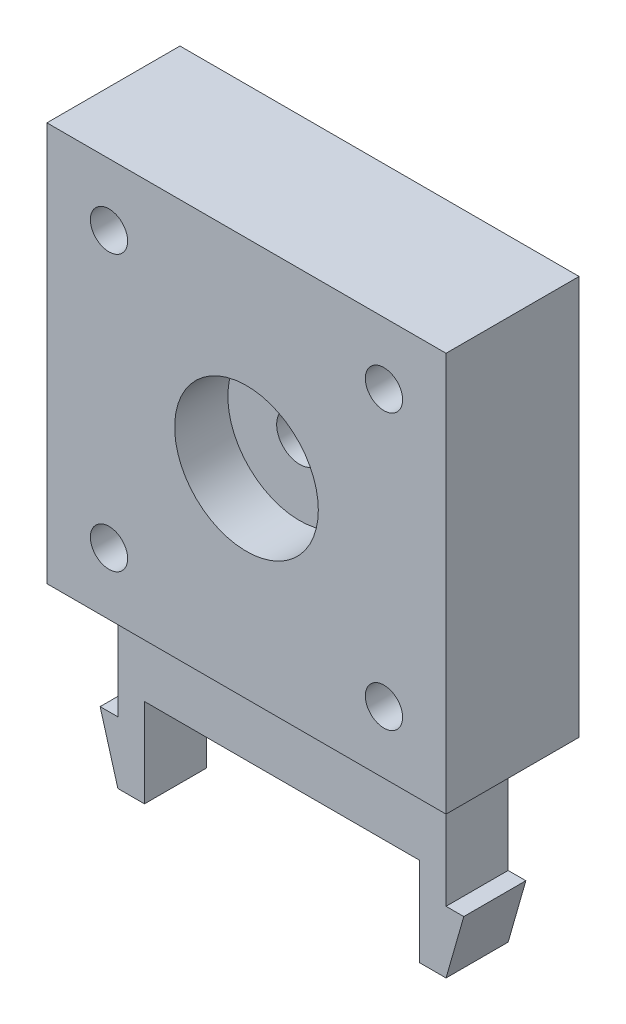
from build123d import *

# Parameters (mm, degrees)
SKETCH1_W           = 45
SKETCH1_H           = 45
SKETCH1_R           = 2.6
BOSS_EXTRUDE1_DEPTH = 7.5
SKETCH2_R           = 8.1
CUT_EXTRUDE1_DEPTH  = 6
CUT_EXTRUDE4_START  = -6
SKETCH5_R           = 8.1
CUT_EXTRUDE4_DEPTH  = 6
SKETCH7_W           = 37
SKETCH7_H           = 7
BOSS_EXTRUDE2_DEPTH = 10
CUT_EXTRUDE6_START  = 2
CUT_EXTRUDE6_DEPTH  = 3.6
CUT_EXTRUDE7_START  = -2
SKETCH8_R           = 2.1
CUT_EXTRUDE7_DEPTH  = 41.278836313
SKETCH9_W           = 3
SKETCH9_H           = 7
BOSS_EXTRUDE3_DEPTH = 10
SKETCH10_W          = 7
SKETCH10_H          = 7
BOSS_EXTRUDE4_DEPTH = 2
CHAMFER2_SIZE2      = 7
CHAMFER2_SIZE       = 2
CHAMFER3_SIZE2      = 7
CHAMFER3_SIZE       = 2


with BuildPart() as part:
    # Sketch1 → Boss-Extrude1 (new, symmetric)
    with BuildSketch(Plane.XY):
        Rectangle(SKETCH1_W, SKETCH1_H)
        Circle(SKETCH1_R, mode=Mode.SUBTRACT)
    extrude(amount=BOSS_EXTRUDE1_DEPTH, both=True)

    # Sketch2 → Cut-Extrude1 (cut)
    with BuildSketch(Plane.XY.offset(7.5)):
        Circle(SKETCH2_R)
    extrude(amount=-CUT_EXTRUDE1_DEPTH, mode=Mode.SUBTRACT)

    # Sketch5 → Cut-Extrude4 (cut)
    with BuildSketch(Plane(origin=(0, 0, -7.5), x_dir=(-1, 0, 0), z_dir=(0, 0, -1)).offset(CUT_EXTRUDE4_START)):
        with Locations(Location((0, 0, 0), (0, 0, 180))):
            Circle(SKETCH5_R)
    extrude(amount=CUT_EXTRUDE4_DEPTH, mode=Mode.SUBTRACT)

    # Sketch7 → Boss-Extrude2 (add)
    with BuildSketch(Plane.XZ.offset(22.5)):
        Rectangle(SKETCH7_W, SKETCH7_H)
    extrude(amount=BOSS_EXTRUDE2_DEPTH)

    # Sketch6 → Cut-Extrude6 (cut)
    with BuildSketch(Plane.XY.offset(-7.5).offset(CUT_EXTRUDE6_START)):
        Polygon((19.2, 17.636195996), (15.5, 19.772391992), (11.8, 17.636195996), (11.8, 13.363804004), (15.5, 11.227608008), (19.2, 13.363804004), align=None)
        Polygon((-11.8, 17.636195996), (-15.5, 19.772391992), (-19.2, 17.636195996), (-19.2, 13.363804004), (-15.5, 11.227608008), (-11.8, 13.363804004), align=None)
        Polygon((19.2, -13.363804004), (15.5, -11.227608008), (11.8, -13.363804004), (11.8, -17.636195996), (15.5, -19.772391992), (19.2, -17.636195996), align=None)
        Polygon((-11.8, -13.363804004), (-15.5, -11.227608008), (-19.2, -13.363804004), (-19.2, -17.636195996), (-15.5, -19.772391992), (-11.8, -17.636195996), align=None)
    extrude(amount=CUT_EXTRUDE6_DEPTH, mode=Mode.SUBTRACT)

    # Sketch8 → Cut-Extrude7 (cut, through all)
    with BuildSketch(Plane(origin=(0, 0, -7.5), x_dir=(-1, 0, 0), z_dir=(0, 0, -1)).offset(CUT_EXTRUDE7_START)):
        with Locations((-15.5, 15.5)):
            Circle(SKETCH8_R)
        with Locations((15.5, 15.5)):
            Circle(SKETCH8_R)
        with Locations((15.5, -15.5)):
            Circle(SKETCH8_R)
        with Locations((-15.5, -15.5)):
            Circle(SKETCH8_R)
    extrude(amount=-CUT_EXTRUDE7_DEPTH, mode=Mode.SUBTRACT)

    # Sketch9 → Boss-Extrude3 (add)
    with BuildSketch(Plane.XZ.offset(32.5)):
        with Locations((-17, 0)):
            Rectangle(SKETCH9_W, SKETCH9_H)
        with Locations((17, 0)):
            Rectangle(SKETCH9_W, SKETCH9_H)
    extrude(amount=BOSS_EXTRUDE3_DEPTH)

    # Sketch10 → Boss-Extrude4 (add)
    with BuildSketch(Plane.ZY.offset(18.5)):
        with Locations((0, -39)):
            Rectangle(SKETCH10_W, SKETCH10_H)
    boss_extrude4 = extrude(amount=BOSS_EXTRUDE4_DEPTH)

    # Mirror1: Boss-Extrude4 across plane
    add(boss_extrude4.mirror(Plane(origin=(0, 0, 0), x_dir=(0, 0, 1), z_dir=(1, 0, 0))))

    # Chamfer2
    chamfer2_edges = [part.edges().sort_by_distance(p)[0] for p in [
        (-20.5, -42.5, 0),
    ]]
    chamfer2_side = [part.faces().sort_by_distance(p)[0] for p in [
        (-20.46, -42.5, 0),
    ]]
    chamfer(chamfer2_edges, length=CHAMFER2_SIZE - 0.0001, length2=CHAMFER2_SIZE2 - 0.0001, reference=chamfer2_side[0])  # a hair under: the kernel refuses the full size

    # Chamfer3
    chamfer3_edges = [part.edges().sort_by_distance(p)[0] for p in [
        (20.5, -42.5, 0),
    ]]
    chamfer3_side = [part.faces().sort_by_distance(p)[0] for p in [
        (20.46, -42.5, 0),
    ]]
    chamfer(chamfer3_edges, length=CHAMFER3_SIZE - 0.0001, length2=CHAMFER3_SIZE2 - 0.0001, reference=chamfer3_side[0])  # a hair under: the kernel refuses the full size


solid = part.part
